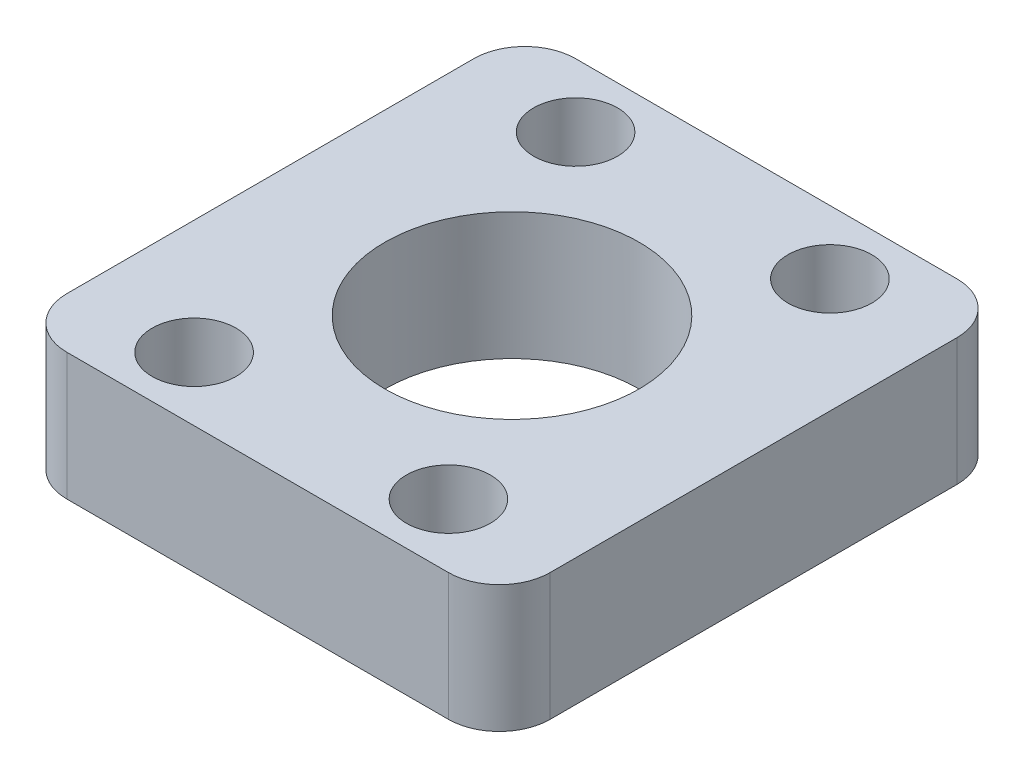
from build123d import *

# Parameters (mm, degrees)
SKETCH_1_W          = 19
SKETCH_1_H          = 20
EXTRUDE_1_DEPTH     = 5
SKETCH_2_R          = 1.65
CUT_EXTRUDE_1_DEPTH = 15.671400751
FILLET_1_R          = 2
SKETCH_3_R          = 5
CUT_EXTRUDE_2_DEPTH = 10


with BuildPart() as part:
    # 草图1 → 凸台-拉伸1 (new body)
    with BuildSketch(Plane(origin=(0, 0, 0), x_dir=(1, 0, 0), z_dir=(0, 1, 0))):
        Rectangle(SKETCH_1_W, SKETCH_1_H)
    extrude(amount=EXTRUDE_1_DEPTH)

    # 草图2 → 切除-拉伸1 (cut, through all)
    with BuildSketch(Plane(origin=(0, 5, 0), x_dir=(1, 0, 0), z_dir=(0, 1, 0))):
        with Locations((-5, 7.5)):
            Circle(SKETCH_2_R)
        with Locations((5, 7.5)):
            Circle(SKETCH_2_R)
        with Locations((5, -7.5)):
            Circle(SKETCH_2_R)
        with Locations((-5, -7.5)):
            Circle(SKETCH_2_R)
    extrude(amount=-CUT_EXTRUDE_1_DEPTH, mode=Mode.SUBTRACT)

    # 圆角1
    fillet_1_edges = [part.edges().sort_by_distance(p)[0] for p in [
        (9.5, 2.5, -10),
        (9.5, 2.5, 10),
        (-9.5, 2.5, 10),
        (-9.5, 2.5, -10),
    ]]
    fillet(fillet_1_edges, radius=FILLET_1_R)

    # 草图3 → 切除-拉伸2 (cut)
    with BuildSketch(Plane(origin=(0, 5, 0), x_dir=(1, 0, 0), z_dir=(0, 1, 0))):
        Circle(SKETCH_3_R)
    extrude(amount=-CUT_EXTRUDE_2_DEPTH, mode=Mode.SUBTRACT)


solid = part.part
